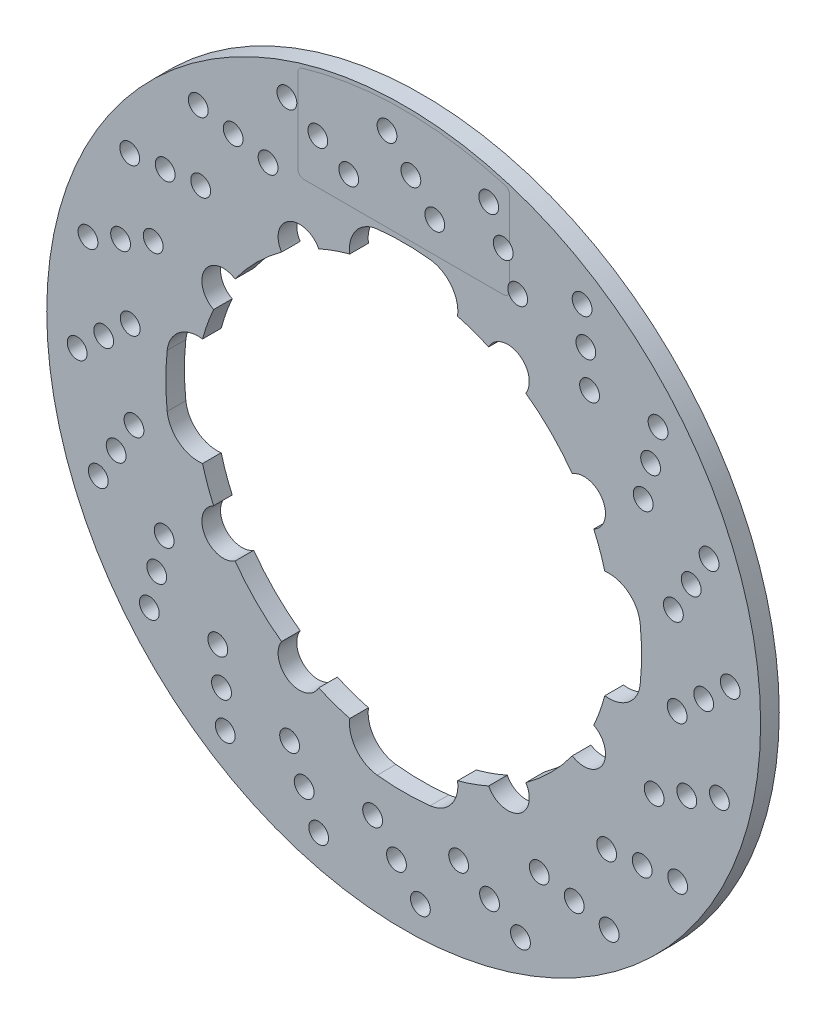
from build123d import *

# Parameters (mm, degrees)
SKETCH1_R                 = 114.3
SKETCH1_R_2               = 76.2
BOSS_EXTRUDE1_DEPTH       = 5.969
SKETCH2_R                 = 3.175
CUT_EXTRUDE1_DEPTH        = 12.7
CIRPATTERN5_COUNT         = 20
SKETCH9_R                 = 4.5
BOSS_EXTRUDE4_DEPTH       = 5.969
FILLET1_R                 = 6.35
CIRPATTERN8_COUNT         = 5
FILLET1_OF_CIRPATTERN8_R  = 6.35
SKETCH14_R                = 76.2
SKETCH14_R_2              = 34.925
BOSS_EXTRUDE6_DEPTH       = 5.969
SKETCH16_R                = 4.5
CUT_EXTRUDE3_DEPTH        = 5.969
CIRPATTERN9_COUNT         = 5
SKETCH17_R                = 66.675
SKETCH17_R_2              = 6.88
CUT_EXTRUDE4_DEPTH        = 5.969
CIRPATTERN10_COUNT        = 4
CUT_EXTRUDE6_DEPTH        = 162.754780334
FILLET2_R                 = 10
CIRPATTERN11_COUNT        = 4
FILLET2_OF_CIRPATTERN11_R = 10


with BuildPart() as part:
    # Sketch1 → Boss-Extrude1 (new body)
    with BuildSketch(Plane.XY):
        Circle(SKETCH1_R)
        Circle(SKETCH1_R_2, mode=Mode.SUBTRACT)
    extrude(amount=BOSS_EXTRUDE1_DEPTH)

    # Sketch2 → Cut-Extrude1 (cut)
    with BuildSketch(Plane.XY.offset(5.969)):
        with Locations((-37.394976935, 97.79)):
            Circle(SKETCH2_R)
        with Locations((-27.49630657, 92.075)):
            Circle(SKETCH2_R)
        with Locations((-17.597636205, 86.36)):
            Circle(SKETCH2_R)
    cut_extrude1 = extrude(amount=-CUT_EXTRUDE1_DEPTH, mode=Mode.SUBTRACT)

    # CirPattern5: Cut-Extrude1 ×20 about axis
    cirpattern5_axis = Axis((0, 0, 0), (0, 0, 1))
    for i in range(1, CIRPATTERN5_COUNT):
        add(cut_extrude1.rotate(cirpattern5_axis, i * 360 / CIRPATTERN5_COUNT), mode=Mode.SUBTRACT)

    # Sketch9 → Boss-Extrude4 (add)
    with BuildSketch(Plane(origin=(0, 0, 0), x_dir=(-1, 0, 0), z_dir=(0, 0, -1))):
        with BuildLine():
            Line((7.427010516, 41.456201743), (12.172412147, 75.221488835))
            ThreePointArc((12.172412147, 75.221488835), (0, 76.2), (-12.172412147, 75.221488835))
            Line((-12.172412147, 75.221488835), (-7.427010516, 41.456201743))
            ThreePointArc((-7.427010516, 41.456201743), (0, 35), (7.427010516, 41.456201743))
        make_face()
        with Locations((0, 42.5)):
            Circle(SKETCH9_R, mode=Mode.SUBTRACT)
    boss_extrude4 = extrude(amount=-BOSS_EXTRUDE4_DEPTH)

    # Fillet1
    fillet1_edges = [part.edges().sort_by_distance(p)[0] for p in [
        (12.172412147, 75.221488835, 2.9845),
        (-12.172412147, 75.221488835, 2.9845),
    ]]
    fillet(fillet1_edges, radius=FILLET1_R)

    # CirPattern8: Boss-Extrude4 ×5 about axis
    cirpattern8_axis = Axis((0, 0, 0), (0, 0, 1))
    for i in range(1, CIRPATTERN8_COUNT):
        add(boss_extrude4.rotate(cirpattern8_axis, i * 360 / CIRPATTERN8_COUNT))

    # Fillet1 of CirPattern8
    fillet1_of_cirpattern8_edges = [part.edges().sort_by_distance(p)[0] for p in [
        (-67.778404906, 34.821370284, 2.9845),
        (-75.301369338, 11.6680665, 2.9845),
        (-54.061770082, -53.700698464, 2.9845),
        (-34.366393503, -68.010227155, 2.9845),
        (34.366393503, -68.010227155, 2.9845),
        (54.061770082, -53.700698464, 2.9845),
        (75.301369338, 11.6680665, 2.9845),
        (67.778404906, 34.821370284, 2.9845),
    ]]
    fillet(fillet1_of_cirpattern8_edges, radius=FILLET1_OF_CIRPATTERN8_R)

    # Sketch14 → Boss-Extrude6 (add)
    with BuildSketch(Plane.XY):
        Circle(SKETCH14_R)
        Circle(SKETCH14_R_2, mode=Mode.SUBTRACT)
    extrude(amount=BOSS_EXTRUDE6_DEPTH)

    # Sketch16 → Cut-Extrude3 (cut)
    with BuildSketch(Plane.XY):
        with Locations((0, 42.5)):
            Circle(SKETCH16_R)
    cut_extrude3 = extrude(amount=CUT_EXTRUDE3_DEPTH, mode=Mode.SUBTRACT)

    # CirPattern9: Cut-Extrude3 ×5 about axis
    cirpattern9_axis = Axis((0, 0, 0), (0, 0, 1))
    for i in range(1, CIRPATTERN9_COUNT):
        add(cut_extrude3.rotate(cirpattern9_axis, i * 360 / CIRPATTERN9_COUNT), mode=Mode.SUBTRACT)

    # Sketch17 → Cut-Extrude4 (cut)
    with BuildSketch(Plane(origin=(0, 0, 0), x_dir=(-1, 0, 0), z_dir=(0, 0, -1))):
        Circle(SKETCH17_R)
        with Locations((-33.3375, 57.742243797)):
            Circle(SKETCH17_R_2)
        with Locations((-57.742243797, 33.3375)):
            Circle(SKETCH17_R_2)
    cut_extrude4 = extrude(amount=-CUT_EXTRUDE4_DEPTH, mode=Mode.SUBTRACT)

    # CirPattern10: Cut-Extrude4 ×4 about axis
    cirpattern10_axis = Axis((0, 0, 0), (0, 0, 1))
    for i in range(1, CIRPATTERN10_COUNT):
        add(cut_extrude4.rotate(cirpattern10_axis, i * 360 / CIRPATTERN10_COUNT), mode=Mode.SUBTRACT)

    # Sketch19 → Cut-Extrude6 (cut, through all)
    with BuildSketch(Plane(origin=(0, 0, 0), x_dir=(-1, 0, 0), z_dir=(0, 0, -1))):
        with BuildLine():
            Line((-19.722011237, 73.603547963), (-17.256759832, 64.403104468))
            ThreePointArc((-17.256759832, 64.403104468), (-8.702833866, 66.104586132), (0, 66.675))
            Line((0, 66.675), (0, 76.2))
            ThreePointArc((0, 76.2), (-9.946095847, 75.548098437), (-19.722011237, 73.603547963))
        make_face()
        with BuildLine():
            ThreePointArc((0, 66.675), (8.702833866, 66.104586132), (17.256759832, 64.403104468))
            Line((17.256759832, 64.403104468), (19.722011237, 73.603547963))
            ThreePointArc((19.722011237, 73.603547963), (9.946095847, 75.548098437), (0, 76.2))
            Line((0, 76.2), (0, 66.675))
        make_face()
    cut_extrude6 = extrude(amount=-CUT_EXTRUDE6_DEPTH, mode=Mode.SUBTRACT)

    # Fillet2
    # the kernel refuses this fillet: 10 mm, written as the material it adds along each edge
    with BuildSketch(Plane(origin=(-19.722011237, 73.603547963, 0), x_dir=(0.982649179352288, 0.18547396129450383, 0), z_dir=(0, 0, 1))) as fillet2_piece_1:
        with BuildLine():
            CenterArc((10.704810772, -9.971704141), FILLET2_R, 85.688766621, 91.596368931)
            Line((0.716034569, -9.498048194), (0.516259045, -9.488575075))
            ThreePointArc((0.516259045, -9.488575075), (0.158583202, -4.764058944), (-0.199434083, -0.015034847))
            Line((-0.199434083, -0.015034847), (-0.015034847, 0.199434083))
            ThreePointArc((-0.015034847, 0.199434083), (5.728276551, 0.415614448), (11.471587949, 0.199434083))
            Line((11.471587949, 0.199434083), (11.456553102, 0))
        make_face()
    extrude(amount=5.969)
    with BuildSketch(Plane(origin=(19.722011237, 73.603547963, 0), x_dir=(-0.2588190451025574, -0.9659258262890585, 0), z_dir=(0, 0, 1))) as fillet2_piece_2:
        with BuildLine():
            CenterArc((10.748214286, -9.92490538), FILLET2_R, 97.026097827, 91.596368931)
            Line((0.861237592, -11.4241358), (0.663498058, -11.454120409))
            ThreePointArc((0.663498058, -11.454120409), (0.016180365, -5.743311398), (-0.2, 0))
            Line((-0.2, 0), (0, 0.2))
            ThreePointArc((0, 0.2), (4.7625, 0.2), (9.500535714, 0.198498108))
            Line((9.500535714, 0.198498108), (9.525, 0))
        make_face()
    extrude(amount=5.969)

    # CirPattern11: Cut-Extrude6 ×4 about axis
    cirpattern11_axis = Axis((0, 0, 0), (0, 0, 1))
    for i in range(1, CIRPATTERN11_COUNT):
        add(cut_extrude6.rotate(cirpattern11_axis, i * 360 / CIRPATTERN11_COUNT), mode=Mode.SUBTRACT)

    # Fillet2 of CirPattern11
    # the kernel refuses this fillet: 10 mm, written as the material it adds along each edge
    with BuildSketch(Plane(origin=(-73.603547963, -19.722011237, 0), x_dir=(0.9659258262890572, 0.2588190451025623, 0), z_dir=(0, 0, 1)), Plane(origin=(19.722011237, -73.603547963, 0), x_dir=(-0.2588190451025616, 0.9659258262890574, 0), z_dir=(0, 0, 1)), Plane(origin=(73.603547963, 19.722011237, 0), x_dir=(-0.9659258262890574, -0.2588190451025616, 0), z_dir=(0, 0, 1))) as fillet2_of_cirpattern11_piece_1:
        with BuildLine():
            CenterArc((10.748214286, 9.92490538), FILLET2_OF_CIRPATTERN11_R, 171.377533242, 91.596368931)
            Line((0.861237592, 11.4241358), (0.663498058, 11.454120409))
            ThreePointArc((0.663498058, 11.454120409), (0.016180365, 5.743311398), (-0.2, 0))
            Line((-0.2, 0), (0, -0.2))
            ThreePointArc((0, -0.2), (4.7625, -0.2), (9.500535714, -0.198498108))
            Line((9.500535714, -0.198498108), (9.525, 0))
        make_face()
    extrude(amount=5.969)
    with BuildSketch(Plane(origin=(-73.603547963, 19.722011237, 0), x_dir=(-0.18547396129450153, -0.9826491793522883, 0), z_dir=(0, 0, 1)), Plane(origin=(-19.722011237, -73.603547963, 0), x_dir=(0.9826491793522883, -0.18547396129450153, 0), z_dir=(0, 0, 1)), Plane(origin=(73.603547963, -19.722011237, 0), x_dir=(0.18547396129450147, 0.9826491793522883, 0), z_dir=(0, 0, 1))) as fillet2_of_cirpattern11_piece_2:
        with BuildLine():
            CenterArc((10.704810772, 9.971704141), FILLET2_OF_CIRPATTERN11_R, 182.714864448, 91.596368931)
            Line((0.716034569, 9.498048194), (0.516259045, 9.488575075))
            ThreePointArc((0.516259045, 9.488575075), (0.158583202, 4.764058944), (-0.199434083, 0.015034847))
            Line((-0.199434083, 0.015034847), (-0.015034847, -0.199434083))
            ThreePointArc((-0.015034847, -0.199434083), (5.728276551, -0.415614448), (11.471587949, -0.199434083))
            Line((11.471587949, -0.199434083), (11.456553102, 0))
        make_face()
    extrude(amount=5.969)


solid = part.part
